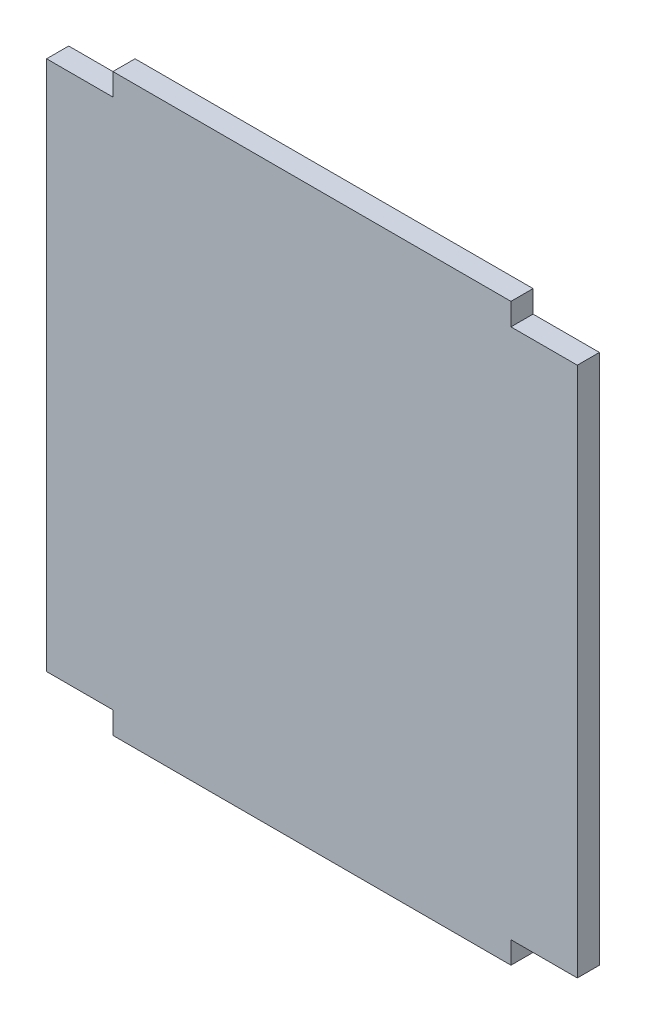
from build123d import *

# Parameters (mm, degrees)
SKETCH1_W           = 76.2
SKETCH1_H           = 82.55
BOSS_EXTRUDE1_DEPTH = 3.175
SKETCH2_W           = 9.525
SKETCH2_H           = 3.175
CUT_EXTRUDE1_DEPTH  = 57.261143341


with BuildPart() as part:
    # Sketch1 → Boss-Extrude1 (new body)
    with BuildSketch(Plane.XY):
        Rectangle(SKETCH1_W, SKETCH1_H)
    extrude(amount=BOSS_EXTRUDE1_DEPTH)

    # Sketch2 → Cut-Extrude1 (cut, through all)
    with BuildSketch(Plane(origin=(0, 0, 0), x_dir=(-1, 0, 0), z_dir=(0, 0, -1))):
        with Locations((-33.3375, -39.6875)):
            Rectangle(SKETCH2_W, SKETCH2_H)
        with Locations((33.3375, -39.6875)):
            Rectangle(SKETCH2_W, SKETCH2_H)
        with Locations((33.3375, 39.6875)):
            Rectangle(SKETCH2_W, SKETCH2_H)
        with Locations((-33.3375, 39.6875)):
            Rectangle(SKETCH2_W, SKETCH2_H)
    extrude(amount=-CUT_EXTRUDE1_DEPTH, mode=Mode.SUBTRACT)


solid = part.part
